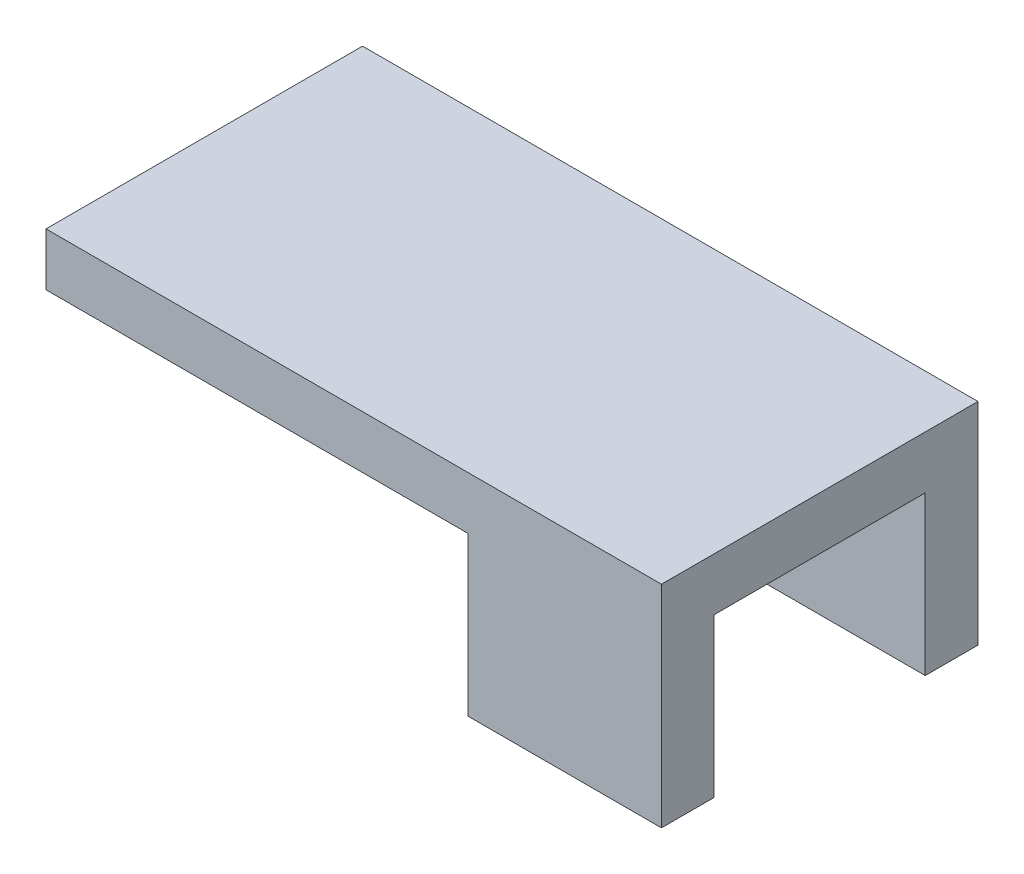
from build123d import *

# Parameters (mm, degrees)
SKETCH1_W           = 35
SKETCH1_H           = 18
BOSS_EXTRUDE1_DEPTH = 3
SKETCH2_W           = 11
SKETCH2_H           = 3
BOSS_EXTRUDE2_DEPTH = 9


with BuildPart() as part:
    # Sketch1 → Boss-Extrude1 (new body)
    with BuildSketch(Plane(origin=(0, 0, 0), x_dir=(1, 0, 0), z_dir=(0, 1, 0))):
        with Locations((17.5, 9)):
            Rectangle(SKETCH1_W, SKETCH1_H)
    extrude(amount=BOSS_EXTRUDE1_DEPTH)

    # Sketch2 → Boss-Extrude2 (add)
    with BuildSketch(Plane.XZ):
        with Locations((29.5, -1.5)):
            Rectangle(SKETCH2_W, SKETCH2_H)
        with Locations((29.5, -16.5)):
            Rectangle(SKETCH2_W, SKETCH2_H)
    extrude(amount=BOSS_EXTRUDE2_DEPTH)


solid = part.part
